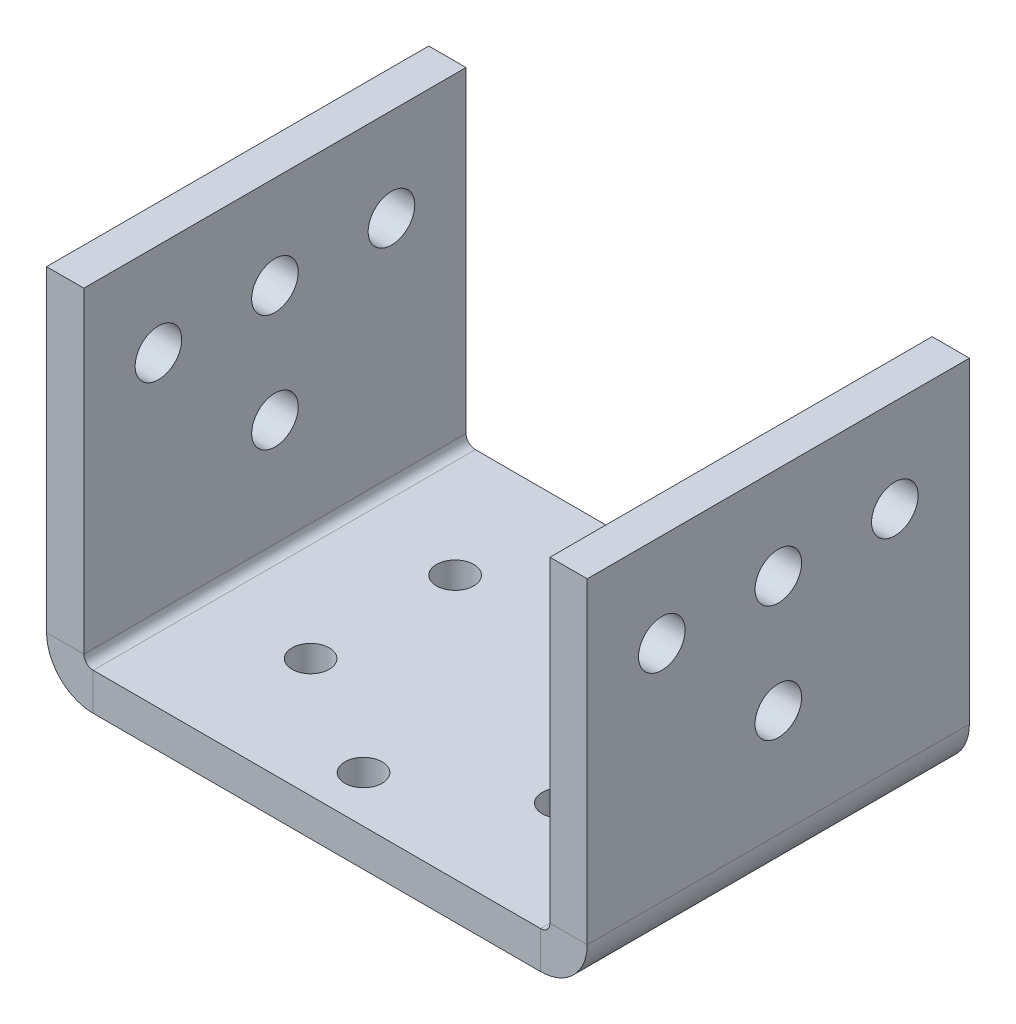
from build123d import *

# Parameters (mm, degrees)
SM_BASE_FLANGE_1_DEPTH   = 41
SKETCH_9_R               = 2
CUT_EXTRUDE_4_DEPTH      = 64.584589328
CUT_EXTRUDE_5_DEPTH      = 80.183331579
CUT_EXTRUDE_5_DEPTH_BACK = 80.183331579
SKETCH_10_R              = 2.5


# Sheet-metal steps are written as plain solids
with BuildPart() as part:
    # Sketch 1 → Базовая кромка1 (new body)
    with BuildSketch(Plane.XY):
        with BuildLine():
            Line((-25, 35), (-25, 1))
            ThreePointArc((-25, 1), (-24.707106781, 0.292893219), (-24, 0))
            Line((-24, 0), (24, 0))
            ThreePointArc((24, 0), (24.707106781, 0.292893219), (25, 1))
            Line((25, 1), (25, 35))
            Line((25, 35), (29, 35))
            Line((29, 35), (29, 1))
            ThreePointArc((29, 1), (27.535533906, -2.535533906), (24, -4))
            Line((24, -4), (-24, -4))
            ThreePointArc((-24, -4), (-27.535533906, -2.535533906), (-29, 1))
            Line((-29, 1), (-29, 35))
            Line((-29, 35), (-25, 35))
        make_face()
    extrude(amount=SM_BASE_FLANGE_1_DEPTH)

    # Эскиз9 → Вырез-Вытянуть4 (cut, through all)
    with BuildSketch(Plane.XZ.offset(4)):
        with Locations((0, 5)):
            Circle(SKETCH_9_R)
        with Locations((-13.423393759, 12.75)):
            Circle(SKETCH_9_R)
        with Locations((-13.423393759, 28.25)):
            Circle(SKETCH_9_R)
        with Locations((0, 36)):
            Circle(SKETCH_9_R)
        with Locations((13.423393759, 28.25)):
            Circle(SKETCH_9_R)
        with Locations((13.423393759, 12.75)):
            Circle(SKETCH_9_R)
    extrude(amount=-CUT_EXTRUDE_4_DEPTH, mode=Mode.SUBTRACT)

    # Эскиз10 → Вырез-Вытянуть5 (cut, two sides: drawn at the far end of the back side and taken through both)
    with BuildSketch(Plane(origin=(29, 0, 0), x_dir=(0, 0, -1), z_dir=(1, 0, 0)).offset(-CUT_EXTRUDE_5_DEPTH_BACK)):
        with Locations((-33, 25)):
            Circle(SKETCH_10_R)
        with Locations((-20.5, 25)):
            Circle(SKETCH_10_R)
        with Locations((-8, 25)):
            Circle(SKETCH_10_R)
        with Locations((-20.5, 12.5)):
            Circle(SKETCH_10_R)
    extrude(amount=CUT_EXTRUDE_5_DEPTH + CUT_EXTRUDE_5_DEPTH_BACK, mode=Mode.SUBTRACT)


solid = part.part
